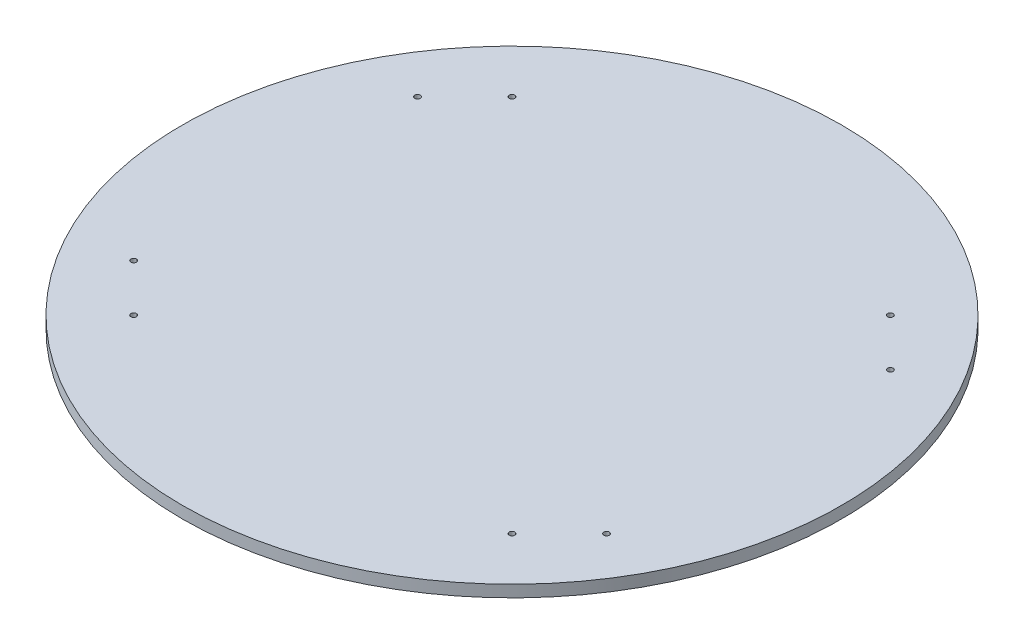
from build123d import *

# Parameters (mm, degrees)
SKETCH1_R           = 177
SKETCH1_R_2         = 1.5
BOSS_EXTRUDE1_DEPTH = 6.35


with BuildPart() as part:
    # Sketch1 → Boss-Extrude1 (new body)
    with BuildSketch(Plane(origin=(0, 0, 0), x_dir=(1, 0, 0), z_dir=(0, 1, 0))):
        Circle(SKETCH1_R)
        with Locations((-101.6, -101.6)):
            Circle(SKETCH1_R_2, mode=Mode.SUBTRACT)
        with Locations((-101.6, 101.6)):
            Circle(SKETCH1_R_2, mode=Mode.SUBTRACT)
        with Locations((101.6, 101.6)):
            Circle(SKETCH1_R_2, mode=Mode.SUBTRACT)
        with Locations((101.6, -101.6)):
            Circle(SKETCH1_R_2, mode=Mode.SUBTRACT)
        with Locations((-127, 76.2)):
            Circle(SKETCH1_R_2, mode=Mode.SUBTRACT)
        with Locations((127, 76.2)):
            Circle(SKETCH1_R_2, mode=Mode.SUBTRACT)
        with Locations((127, -76.2)):
            Circle(SKETCH1_R_2, mode=Mode.SUBTRACT)
        with Locations((-127, -76.2)):
            Circle(SKETCH1_R_2, mode=Mode.SUBTRACT)
    extrude(amount=BOSS_EXTRUDE1_DEPTH)


solid = part.part
